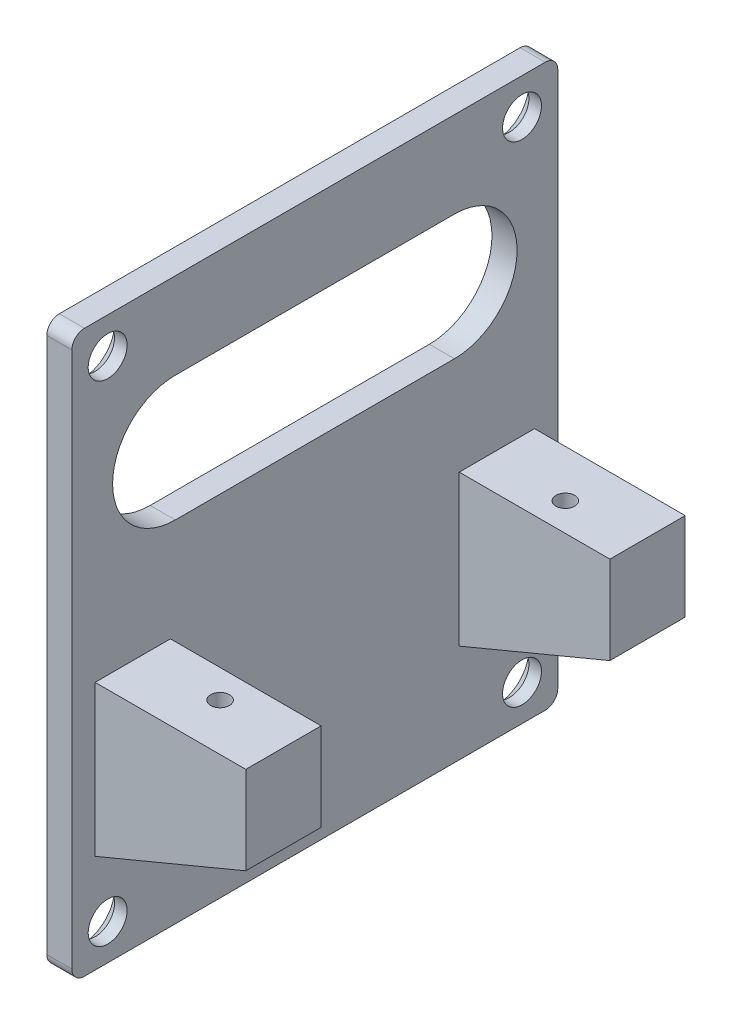
from build123d import *
from OCP.BRepFilletAPI import BRepFilletAPI_MakeChamfer

# Parameters (mm, degrees)
SKETCH1_W               = 39
SKETCH1_H               = 45
SKETCH1_R               = 1.55
BOSS_EXTRUDE1_DEPTH     = 2
SKETCH2_W               = 6
SKETCH2_H               = 7
BOSS_EXTRUDE2_DEPTH     = 12
CHAMFER1_SIZE           = 5
CHAMFER1_SIZE_2         = 12
CUT_EXTRUDE1_DEPTH      = 12
CUT_EXTRUDE1_DEPTH_BACK = 22
SKETCH3_R               = 0.75
CUT_EXTRUDE2_DEPTH      = 33.101401839
CUT_EXTRUDE2_DEPTH_BACK = 33.101401839
SKETCH4_W               = 39
SKETCH4_H               = 45
SKETCH4_W_2             = 38.7
SKETCH4_H_2             = 44.7
FILLET1_R               = 1
CHAMFER2_SIZE           = 1


with BuildPart() as part:
    # Sketch1 → Boss-Extrude1 (new body)
    with BuildSketch(Plane(origin=(0, 0, 0), x_dir=(0, 0, -1), z_dir=(1, 0, 0))):
        Rectangle(SKETCH1_W, SKETCH1_H)
        with Locations((-16.5, 19.5)):
            Circle(SKETCH1_R, mode=Mode.SUBTRACT)
        with Locations((16.5, 19.5)):
            Circle(SKETCH1_R, mode=Mode.SUBTRACT)
        with Locations((16.5, -19.5)):
            Circle(SKETCH1_R, mode=Mode.SUBTRACT)
        with Locations((-16.5, -19.5)):
            Circle(SKETCH1_R, mode=Mode.SUBTRACT)
        with BuildLine():
            Line((-11.118955155, 15.489657916), (11.118955155, 15.489657916))
            ThreePointArc((11.118955155, 15.489657916), (16.108613071, 10.5), (11.118955155, 5.510342084))
            Line((11.118955155, 5.510342084), (-11.118955155, 5.510342084))
            ThreePointArc((-11.118955155, 5.510342084), (-16.108613071, 10.5), (-11.118955155, 15.489657916))
        make_face(mode=Mode.SUBTRACT)
    extrude(amount=BOSS_EXTRUDE1_DEPTH)

    # Sketch2 → Boss-Extrude2 (add)
    with BuildSketch(Plane(origin=(2, 0, 0), x_dir=(0, 0, -1), z_dir=(1, 0, 0))):
        with Locations((14.5, -6)):
            Rectangle(SKETCH2_W, SKETCH2_H)
        with Locations((-14.5, -6)):
            Rectangle(SKETCH2_W, SKETCH2_H)
    extrude(amount=BOSS_EXTRUDE2_DEPTH)

    # Chamfer1
    chamfer1_edges_1 = [part.edges().sort_by_distance(p)[0] for p in [
        (2, -9.5, -14.5),
    ]]
    chamfer1_side_1 = [part.faces().sort_by_distance(p)[0] for p in [
        (2, -9.6, -14.5),
    ]]
    chamfer1_edges_2 = [part.edges().sort_by_distance(p)[0] for p in [
        (2, -9.5, 14.5),
    ]]
    chamfer1_side_2 = [part.faces().sort_by_distance(p)[0] for p in [
        (2, -9.6, 14.5),
    ]]
    chamfer1 = BRepFilletAPI_MakeChamfer(part.part.solid().wrapped)
    for e in chamfer1_edges_1:
        chamfer1.Add(CHAMFER1_SIZE - 0.0001, CHAMFER1_SIZE_2 - 0.0001, e.wrapped, chamfer1_side_1[0].wrapped)
    for e in chamfer1_edges_2:
        chamfer1.Add(CHAMFER1_SIZE - 0.0001, CHAMFER1_SIZE_2 - 0.0001, e.wrapped, chamfer1_side_2[0].wrapped)
    add(Compound.cast(chamfer1.Shape()), mode=Mode.REPLACE)  # a hair under: the kernel refuses the full size

    # Sketch3 → Cut-Extrude1 (cut, two sides: drawn at the far end of the back side and taken through both)
    with BuildSketch(Plane(origin=(0, -2.5, 0), x_dir=(1, 0, 0), z_dir=(0, 1, 0)).offset(-CUT_EXTRUDE1_DEPTH_BACK)):
        with Locations(Location((8.2, -13.75, 0), (0, 0, 90))):
            Circle(SKETCH3_R)
        with Locations(Location((8.2, 13.75, 0), (0, 0, 90))):
            Circle(SKETCH3_R)
    extrude(amount=CUT_EXTRUDE1_DEPTH + CUT_EXTRUDE1_DEPTH_BACK, mode=Mode.SUBTRACT)

    # Sketch4 → Cut-Extrude2 (cut, two sides: drawn at the far end of the back side and taken through both)
    with BuildSketch(Plane(origin=(2, 0, 0), x_dir=(0, 0, -1), z_dir=(1, 0, 0)).offset(-CUT_EXTRUDE2_DEPTH_BACK)):
        Rectangle(SKETCH4_W, SKETCH4_H)
        Rectangle(SKETCH4_W_2, SKETCH4_H_2, mode=Mode.SUBTRACT)
    extrude(amount=CUT_EXTRUDE2_DEPTH + CUT_EXTRUDE2_DEPTH_BACK, mode=Mode.SUBTRACT)

    # Fillet1
    fillet1_edges = [part.edges().sort_by_distance(p)[0] for p in [
        (1, 22.35, -19.35),
        (1, -22.35, -19.35),
        (1, -22.35, 19.35),
        (1, 22.35, 19.35),
    ]]
    fillet(fillet1_edges, radius=FILLET1_R)

    # Chamfer2
    chamfer2_edges = [part.edges().sort_by_distance(p)[0] for p in [
        (0, 19.5, 18.05),
        (0, 19.5, -14.95),
        (0, -19.5, -14.95),
        (0, -19.5, 18.05),
    ]]
    chamfer(chamfer2_edges, length=CHAMFER2_SIZE)


solid = part.part
